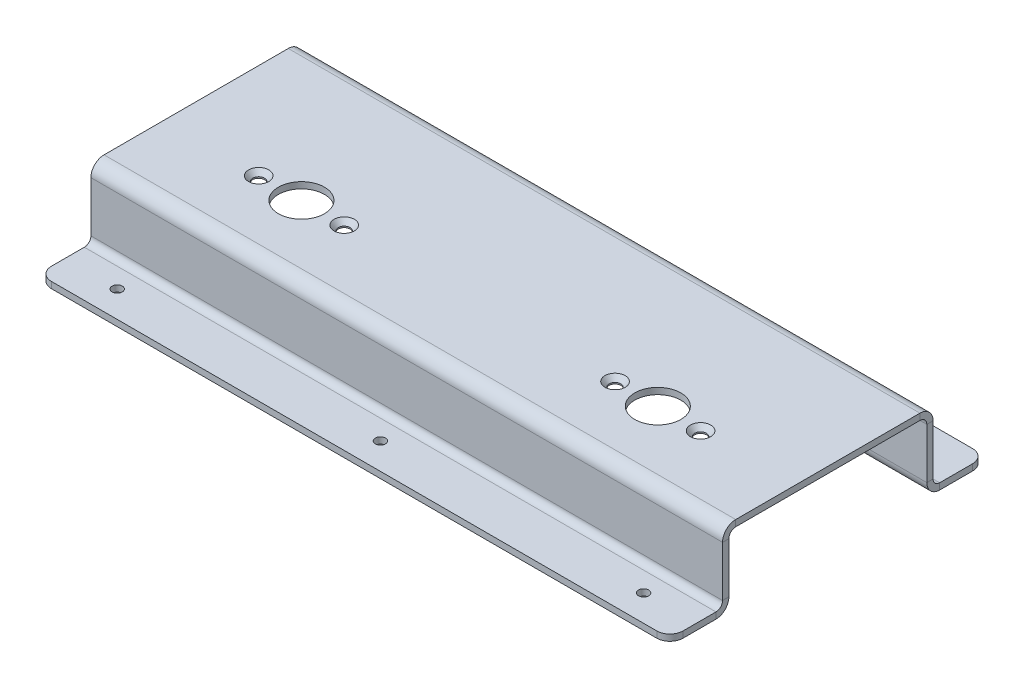
from build123d import *

# Parameters (mm, degrees)
BOSS_EXTRUDE1_DEPTH                                = 304.8
SKETCH2_R                                          = 2.3876
CUT_EXTRUDE1_DEPTH                                 = 317.354227758
SKETCH3_R                                          = 11.1125
CUT_EXTRUDE2_DEPTH                                 = 304.8
CSK_FOR_10_FLAT_HEAD_MACHINE_SCREW1_AT_COUNT       = 2
CSK_FOR_10_FLAT_HEAD_MACHINE_SCREW1_AT_PITCH       = 41.275
LPATTERN1_COUNT                                    = 2
LPATTERN1_PITCH                                    = 171.958
FILLET1_R                                          = 6.35
SKETCH14_R                                         = 4.8895
SKETCH14_R_2                                       = 2.8067
BOSS_EXTRUDE2_DEPTH                                = 3.175
CONVERT_SOLID1_DEPTH                               = 304.8
F_10_0_1935_DIAMETER_HOLE1_D                       = 4.9149
F_10_0_1935_DIAMETER_HOLE1_DEPTH                   = 3.048
CSK_FOR_10_FLAT_HEAD_MACHINE_SCREW_100_D           = 5.6134
CSK_FOR_10_FLAT_HEAD_MACHINE_SCREW_100_DEPTH       = 36.8935
CSK_FOR_10_FLAT_HEAD_MACHINE_SCREW_100_CSINK_D     = 9.779
CSK_FOR_10_FLAT_HEAD_MACHINE_SCREW_100_CSINK_ANGLE = 82


# Read off the part's stored shape, not the designer's step: Convert-Solid1
with BuildPart() as part:
    # Sketch1 → Boss-Extrude1 (new body)
    with BuildSketch(Plane(origin=(0, 0, 0), x_dir=(0, 0, -1), z_dir=(1, 0, 0))):
        with BuildLine():
            Line((-76.2, 4.2545), (-53.975, 4.2545))
            ThreePointArc((-53.975, 4.2545), (-49.484871939, 6.114371939), (-47.625, 10.6045))
            Line((-47.625, 10.6045), (-47.625, 34.925))
            ThreePointArc((-47.625, 34.925), (-46.69506403, 37.17006403), (-44.45, 38.1))
            Line((-44.45, 38.1), (44.45, 38.1))
            ThreePointArc((44.45, 38.1), (46.69506403, 37.17006403), (47.625, 34.925))
            Line((47.625, 34.925), (47.625, 10.6045))
            ThreePointArc((47.625, 10.6045), (49.484871939, 6.114371939), (53.975, 4.2545))
            Line((53.975, 4.2545), (76.2, 4.2545))
            Line((76.2, 4.2545), (76.2, 7.4295))
            Line((76.2, 7.4295), (53.975, 7.4295))
            ThreePointArc((53.975, 7.4295), (51.72993597, 8.35943597), (50.8, 10.6045))
            Line((50.8, 10.6045), (50.8, 34.925))
            ThreePointArc((50.8, 34.925), (48.940128061, 39.415128061), (44.45, 41.275))
            Line((44.45, 41.275), (-44.45, 41.275))
            ThreePointArc((-44.45, 41.275), (-48.940128061, 39.415128061), (-50.8, 34.925))
            Line((-50.8, 34.925), (-50.8, 10.6045))
            ThreePointArc((-50.8, 10.6045), (-51.72993597, 8.35943597), (-53.975, 7.4295))
            Line((-53.975, 7.4295), (-76.2, 7.4295))
            Line((-76.2, 7.4295), (-76.2, 4.2545))
        make_face()
    extrude(amount=BOSS_EXTRUDE1_DEPTH)

    # Sketch2 → Cut-Extrude1 (cut, through all)
    with BuildSketch(Plane.XZ.offset(-4.2545)):
        with Locations(Location((25.4, 63.5, 0), (0, 0, 270))):
            Circle(SKETCH2_R)
        with Locations(Location((152.4, 63.5, 0), (0, 0, 270))):
            Circle(SKETCH2_R)
        with Locations(Location((279.4, 63.5, 0), (0, 0, 270))):
            Circle(SKETCH2_R)
    cut_extrude1 = extrude(amount=-CUT_EXTRUDE1_DEPTH, mode=Mode.SUBTRACT)

    # Mirror1: Cut-Extrude1 across plane
    add(cut_extrude1.mirror(Plane.XY), mode=Mode.SUBTRACT)

    # Sketch3 → Cut-Extrude2 (cut)
    with BuildSketch(Plane(origin=(0, 41.275, 0), x_dir=(1, 0, 0), z_dir=(0, 1, 0))):
        with Locations(Location((66.675, -15.875, 0), (0, 0, 270))):
            Circle(SKETCH3_R)
    cut_extrude2 = extrude(amount=-CUT_EXTRUDE2_DEPTH, mode=Mode.SUBTRACT)

    # Sketch5 → CSK for #10 Flat Head Machine Screw1 (revolve, cut)
    with BuildSketch(Plane(origin=(46.0375, 41.275, 15.875), x_dir=(0, 0, 1), z_dir=(1, 0, 0))):
        Polygon((0, 0), (0, 3.175), (2.8067, 3.175), (2.8067, 2.395987319), (4.8895, 0), align=None)
    csk_for_10_flat_head_machine_screw1 = revolve(axis=Axis((46.0375, 47.625, 15.875), (0, -1, 0)), mode=Mode.SUBTRACT)

    # CSK for #10 Flat Head Machine Screw1 at: CSK for #10 Flat Head Machine Screw1 ×2
    with Locations(*[(i * CSK_FOR_10_FLAT_HEAD_MACHINE_SCREW1_AT_PITCH, 0, 0) for i in range(1, CSK_FOR_10_FLAT_HEAD_MACHINE_SCREW1_AT_COUNT)]):
        add(csk_for_10_flat_head_machine_screw1, mode=Mode.SUBTRACT)

    # LPattern1: Cut-Extrude2, CSK for #10 Flat Head Machine Screw1 ×2
    with Locations(*[(i * LPATTERN1_PITCH, 0, 0) for i in range(1, LPATTERN1_COUNT)]):
        add(cut_extrude2, mode=Mode.SUBTRACT)
        add(csk_for_10_flat_head_machine_screw1, mode=Mode.SUBTRACT)

    # LPattern1 copy 1 sketch → LPattern1 copy 1 (revolve, cut)
    with BuildSketch(Plane(origin=(259.2705, 41.275, 15.875), x_dir=(0, 0, 1), z_dir=(1, 0, 0))):
        Polygon((0, 0), (0, 3.175), (2.8067, 3.175), (2.8067, 2.395987319), (4.8895, 0), align=None)
    revolve(axis=Axis((259.2705, 47.625, 15.875), (0, -1, 0)), mode=Mode.SUBTRACT)

    # Fillet1
    fillet1_edges = [part.edges().sort_by_distance(p)[0] for p in [
        (0, 5.842, -76.2),
        (0, 5.842, 76.2),
        (304.8, 5.842, -76.2),
        (304.8, 5.842, 76.2),
    ]]
    fillet(fillet1_edges, radius=FILLET1_R)

    # Sketch14 → Boss-Extrude2 (add)
    # profile 1 of 4: a face of its own
    with BuildSketch(Plane(origin=(0, 41.275, 0), x_dir=(1, 0, 0), z_dir=(0, 1, 0))):
        with Locations((259.2705, -15.875)):
            Circle(SKETCH14_R)
        with Locations(Location((259.2705, -15.875, 0), (0, 0, 270))):
            Circle(SKETCH14_R_2, mode=Mode.SUBTRACT)
    # profile 2 of 4: a face of its own
    with BuildSketch(Plane(origin=(0, 41.275, 0), x_dir=(1, 0, 0), z_dir=(0, 1, 0))):
        with Locations((87.3125, -15.875)):
            Circle(SKETCH14_R)
        with Locations(Location((87.3125, -15.875, 0), (0, 0, 270))):
            Circle(SKETCH14_R_2, mode=Mode.SUBTRACT)
    # profile 3 of 4: a face of its own
    with BuildSketch(Plane(origin=(0, 41.275, 0), x_dir=(1, 0, 0), z_dir=(0, 1, 0))):
        with Locations((217.9955, -15.875)):
            Circle(SKETCH14_R)
        with Locations(Location((217.9955, -15.875, 0), (0, 0, 270))):
            Circle(SKETCH14_R_2, mode=Mode.SUBTRACT)
    # profile 4 of 4: a face of its own
    with BuildSketch(Plane(origin=(0, 41.275, 0), x_dir=(1, 0, 0), z_dir=(0, 1, 0))):
        with Locations((46.0375, -15.875)):
            Circle(SKETCH14_R)
        with Locations(Location((46.0375, -15.875, 0), (0, 0, 270))):
            Circle(SKETCH14_R_2, mode=Mode.SUBTRACT)
    extrude(amount=-BOSS_EXTRUDE2_DEPTH)

    # Convert-Solid1 outline → Convert-Solid1 (cut)
    with BuildSketch(Plane.YZ):
        with BuildLine():
            Line((4.3815, -76.2), (4.3815, -53.975))
            ThreePointArc((4.3815, -53.975), (6.204174501, -49.574674501), (10.6045, -47.752))
            Line((10.6045, -47.752), (34.925, -47.752))
            ThreePointArc((34.925, -47.752), (37.259866591, -46.784866591), (38.227, -44.45))
            Line((38.227, -44.45), (38.227, 44.45))
            ThreePointArc((38.227, 44.45), (37.259866591, 46.784866591), (34.925, 47.752))
            Line((34.925, 47.752), (10.6045, 47.752))
            ThreePointArc((10.6045, 47.752), (6.204174501, 49.574674501), (4.3815, 53.975))
            Line((4.3815, 53.975), (4.3815, 76.2))
            Line((4.3815, 76.2), (4.2545, 76.2))
            Line((4.2545, 76.2), (4.2545, 53.975))
            ThreePointArc((4.2545, 53.975), (6.114371939, 49.484871939), (10.6045, 47.625))
            Line((10.6045, 47.625), (34.925, 47.625))
            ThreePointArc((34.925, 47.625), (37.17006403, 46.69506403), (38.1, 44.45))
            Line((38.1, 44.45), (38.1, -44.45))
            ThreePointArc((38.1, -44.45), (37.17006403, -46.69506403), (34.925, -47.625))
            Line((34.925, -47.625), (10.6045, -47.625))
            ThreePointArc((10.6045, -47.625), (6.114371939, -49.484871939), (4.2545, -53.975))
            Line((4.2545, -53.975), (4.2545, -76.2))
            Line((4.2545, -76.2), (4.3815, -76.2))
        make_face()
    extrude(amount=CONVERT_SOLID1_DEPTH, mode=Mode.SUBTRACT)

    # #10 (0.1935) Diameter Hole1
    with Locations(Plane(origin=(0, 7.4295, 0), x_dir=(1, 0, 0), z_dir=(0, 1, 0))):
        with Locations((25.4, 63.5), (152.4, 63.5), (279.4, 63.5), (279.4, -63.5), (152.4, -63.5), (25.4, -63.5)):
            Hole(F_10_0_1935_DIAMETER_HOLE1_D / 2, depth=F_10_0_1935_DIAMETER_HOLE1_DEPTH)

    # CSK for #10 Flat Head Machine Screw (100)1
    with Locations(Plane(origin=(0, 41.275, 0), x_dir=(1, 0, 0), z_dir=(0, 1, 0))):
        with Locations((46.0375, -15.875), (87.3125, -15.875), (217.9955, -15.875), (259.2705, -15.875)):
            CounterSinkHole(CSK_FOR_10_FLAT_HEAD_MACHINE_SCREW_100_D / 2, CSK_FOR_10_FLAT_HEAD_MACHINE_SCREW_100_CSINK_D / 2, depth=CSK_FOR_10_FLAT_HEAD_MACHINE_SCREW_100_DEPTH, counter_sink_angle=CSK_FOR_10_FLAT_HEAD_MACHINE_SCREW_100_CSINK_ANGLE)


solid = part.part
